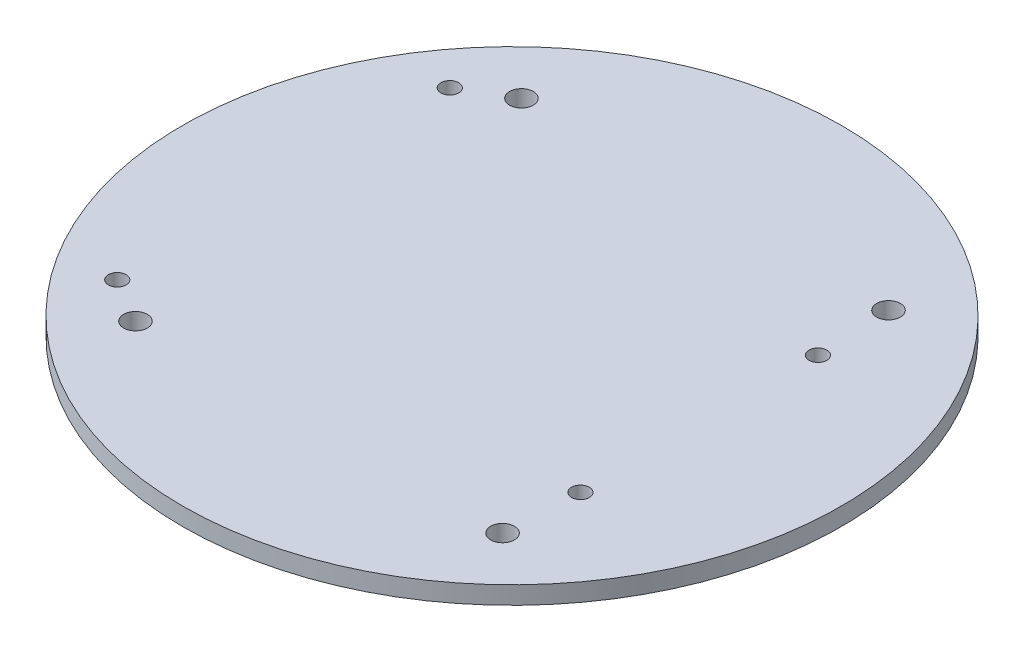
from build123d import *

# Parameters (mm, degrees)
SKETCH7_R                              = 55.5
BOSS_EXTRUDE1_DEPTH                    = 3
F_3_0MM_TRANSITIONAL_DOWEL_HOLE1_D     = 3
F_3_0MM_TRANSITIONAL_DOWEL_HOLE1_DEPTH = 25.4
F_3_0MM_TRANSITIONAL_DOWEL_HOLE1_TIP   = 0.901290929
F_4_0MM_DOWEL_HOLE1_D                  = 4
F_4_0MM_DOWEL_HOLE1_DEPTH              = 25.4
F_4_0MM_DOWEL_HOLE1_TIP                = 1.201721238


with BuildPart() as part:
    # Sketch7 → Boss-Extrude1 (new body)
    with BuildSketch(Plane(origin=(0, 0, 0), x_dir=(1, 0, 0), z_dir=(0, 1, 0))):
        Circle(SKETCH7_R)
    extrude(amount=BOSS_EXTRUDE1_DEPTH)

    # Ø3.0mm Transitional Dowel Hole1
    with Locations(Plane(origin=(0, 3, 0), x_dir=(1, 0, 0), z_dir=(0, 1, 0))):
        with Locations((-38.476262074, 27.999994228), (31.523738554, 19.999999725), (31.523741695, -20.000000275), (-38.476257677, -28.000005772)):
            Hole(F_3_0MM_TRANSITIONAL_DOWEL_HOLE1_D / 2, depth=F_3_0MM_TRANSITIONAL_DOWEL_HOLE1_DEPTH)
            with Locations((0, 0, -(F_3_0MM_TRANSITIONAL_DOWEL_HOLE1_DEPTH + F_3_0MM_TRANSITIONAL_DOWEL_HOLE1_TIP / 2))):  # 118° drill point
                Cone(0, F_3_0MM_TRANSITIONAL_DOWEL_HOLE1_D / 2, F_3_0MM_TRANSITIONAL_DOWEL_HOLE1_TIP, mode=Mode.SUBTRACT)

    # Ø4.0mm Dowel Hole1
    with Locations(Plane(origin=(0, 3, 0), x_dir=(1, 0, 0), z_dir=(0, 1, 0))):
        with Locations((-30.906824904, 32.5), (30.906824904, 32.5), (30.906824904, -32.5), (-30.906824904, -32.5)):
            Hole(F_4_0MM_DOWEL_HOLE1_D / 2, depth=F_4_0MM_DOWEL_HOLE1_DEPTH)
            with Locations((0, 0, -(F_4_0MM_DOWEL_HOLE1_DEPTH + F_4_0MM_DOWEL_HOLE1_TIP / 2))):  # 118° drill point
                Cone(0, F_4_0MM_DOWEL_HOLE1_D / 2, F_4_0MM_DOWEL_HOLE1_TIP, mode=Mode.SUBTRACT)


solid = part.part
